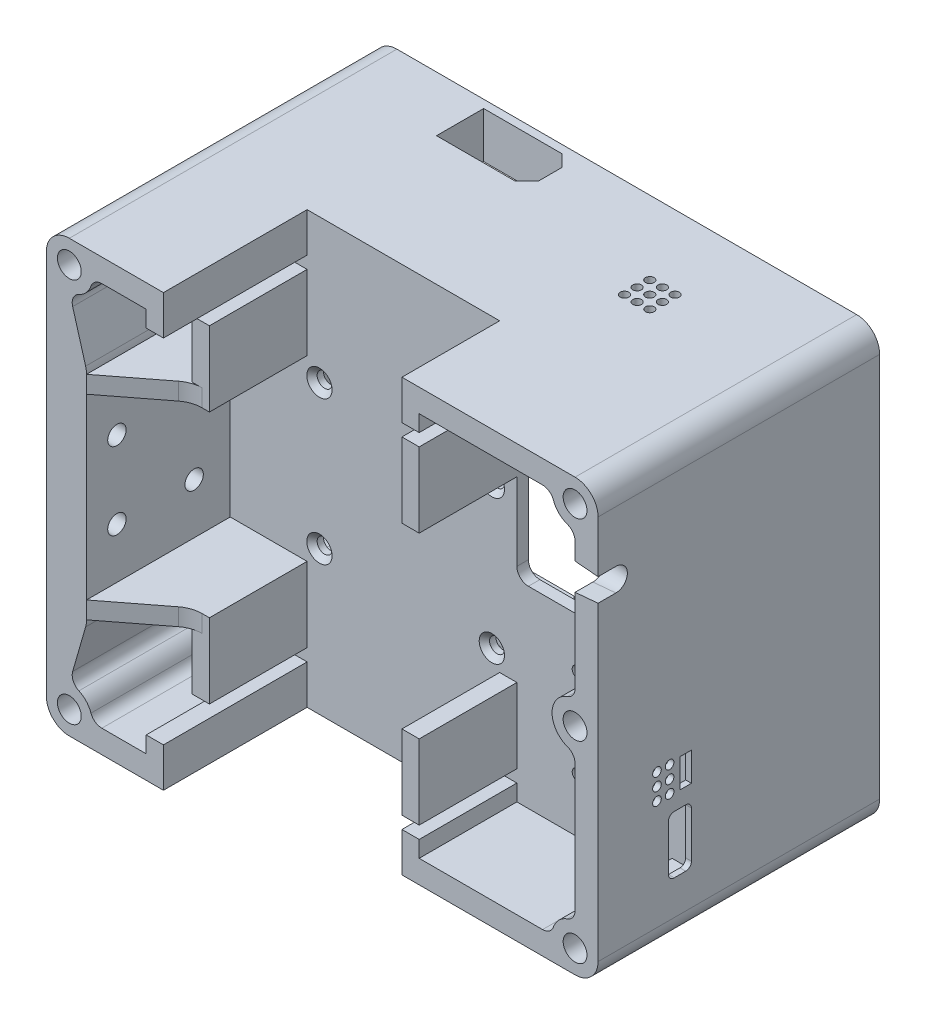
from build123d import *

# Parameters (mm, degrees)
SKETCH1_W                                      = 75
SKETCH1_H                                      = 88
BOSS_EXTRUDE1_DEPTH                            = 2
SKETCH2_W                                      = 3
SKETCH2_H                                      = 13
BOSS_EXTRUDE2_DEPTH                            = 17
SKETCH6_R                                      = 2.075
BOSS_EXTRUDE3_DEPTH                            = 17
SKETCH7_R                                      = 2.075
BOSS_EXTRUDE4_DEPTH                            = 25
SKETCH16_R                                     = 2
CUT_EXTRUDE5_DEPTH                             = 63.98610958
CUT_EXTRUDE2_REACH                             = 95.254
SKETCH8_R                                      = 1.6
BOSS_EXTRUDE5_DEPTH                            = 3
FILLET3_R                                      = 4
CUT_EXTRUDE6_REACH                             = 101.394
SKETCH17_R                                     = 0.75
SKETCH17_W                                     = 5
SKETCH17_H                                     = 2
CUT_EXTRUDE7_START                             = 1
SKETCH18_W                                     = 24
SKETCH18_H                                     = 8
SKETCH18_W_2                                   = 5
SKETCH18_H_2                                   = 2
SKETCH18_R                                     = 0.75
CUT_EXTRUDE7_DEPTH                             = 3.368532
BOSS_EXTRUDE6_START                            = 30
SKETCH19_R                                     = 2.075
BOSS_EXTRUDE6_DEPTH                            = 30
CUT_EXTRUDE8_REACH                             = 102.251
CSK_FOR_M2_FLAT_HEAD_MACHINE_SCREW1_AT_2_COUNT = 2
CSK_FOR_M2_FLAT_HEAD_MACHINE_SCREW1_AT_2_PITCH = 30
CSK_FOR_M2_FLAT_HEAD_MACHINE_SCREW1_AT_3_COUNT = 2
CSK_FOR_M2_FLAT_HEAD_MACHINE_SCREW1_AT_3_PITCH = 39.05124838
CSK_FOR_M2_FLAT_HEAD_MACHINE_SCREW1_AT_4_COUNT = 2
CSK_FOR_M2_FLAT_HEAD_MACHINE_SCREW1_AT_4_PITCH = 25
CUT_EXTRUDE9_REACH                             = 68.078
SKETCH24_R                                     = 1
CUT_EXTRUDE10_START                            = -2
CUT_EXTRUDE10_DEPTH                            = 2
CUT_EXTRUDE11_START                            = -2
CUT_EXTRUDE11_DEPTH                            = 2
FILLET4_R                                      = 5
BOSS_EXTRUDE7_DEPTH                            = 4
CUT_EXTRUDE12_DEPTH                            = 86.586213843
CUT_EXTRUDE12_DEPTH_BACK                       = 86.586213843
FILLET5_R                                      = 1
CUT_EXTRUDE13_DEPTH                            = 4
CUT_EXTRUDE13_DRAFT                            = 5
SKETCH32_R                                     = 0.75
CUT_EXTRUDE14_DEPTH                            = 92.983694207


with BuildPart() as part:
    # Sketch1 → Boss-Extrude1 (new body)
    with BuildSketch(Plane(origin=(0, 0, 0), x_dir=(0, 1, 0), z_dir=(0, 0, 1))):
        Rectangle(SKETCH1_W, SKETCH1_H)
    extrude(amount=BOSS_EXTRUDE1_DEPTH)

    # Sketch2 → Boss-Extrude2 (add)
    with BuildSketch(Plane.XY.offset(2)):
        with Locations((11.375727924, -22)):
            Rectangle(SKETCH2_W, SKETCH2_H)
        with Locations((-25.124272076, -22)):
            Rectangle(SKETCH2_W, SKETCH2_H)
    boss_extrude2 = extrude(amount=BOSS_EXTRUDE2_DEPTH)

    # Mirror1: Boss-Extrude2 across plane
    add(boss_extrude2.mirror(Plane.ZX))

    # Sketch6 → Boss-Extrude3 (add)
    with BuildSketch(Plane.XY.offset(2)):
        with BuildLine():
            Line((9.875727924, 37.5), (44, 37.5))
            Line((44, 37.5), (44, -37.5))
            Line((44, -37.5), (9.875727924, -37.5))
            Line((9.875727924, -37.5), (9.875727924, -33.5))
            Line((9.875727924, -33.5), (9.875727924, -30.65))
            Line((9.875727924, -30.65), (12.875727924, -30.65))
            Line((12.875727924, -30.65), (12.875727924, -33.5))
            Line((12.875727924, -33.5), (34.343145751, -33.5))
            ThreePointArc((34.343145751, -33.5), (35.497846289, -33.132993162), (36.228763834, -32.166666667))
            ThreePointArc((36.228763834, -32.166666667), (37.171572875, -30.671572875), (38.666666667, -29.728763834))
            ThreePointArc((38.666666667, -29.728763834), (39.632993162, -28.997846289), (40, -27.843145751))
            Line((40, -27.843145751), (40, -5.656854249))
            ThreePointArc((40, -5.656854249), (39.632993162, -4.502153711), (38.666666667, -3.771236166))
            ThreePointArc((38.666666667, -3.771236166), (36, 0), (38.666666667, 3.771236166))
            ThreePointArc((38.666666667, 3.771236166), (39.632993162, 4.502153711), (40, 5.656854249))
            Line((40, 5.656854249), (40, 27.843145751))
            ThreePointArc((40, 27.843145751), (39.632993162, 28.997846289), (38.666666667, 29.728763834))
            ThreePointArc((38.666666667, 29.728763834), (37.171572875, 30.671572875), (36.228763834, 32.166666667))
            ThreePointArc((36.228763834, 32.166666667), (35.497846289, 33.132993162), (34.343145751, 33.5))
            Line((34.343145751, 33.5), (12.875727924, 33.5))
            Line((12.875727924, 33.5), (12.875727924, 30.65))
            Line((12.875727924, 30.65), (9.875727924, 30.65))
            Line((9.875727924, 30.65), (9.875727924, 33.5))
            Line((9.875727924, 33.5), (9.875727924, 37.5))
        make_face()
        with Locations((40, 33.5)):
            Circle(SKETCH6_R, mode=Mode.SUBTRACT)
        with Locations((40, 0)):
            Circle(SKETCH6_R, mode=Mode.SUBTRACT)
        with Locations((40, -33.5)):
            Circle(SKETCH6_R, mode=Mode.SUBTRACT)
    extrude(amount=BOSS_EXTRUDE3_DEPTH)

    # Sketch7 → Boss-Extrude4 (add)
    with BuildSketch(Plane.XY.offset(2)):
        with BuildLine():
            Line((-23.624272076, 37.5), (-44, 37.5))
            Line((-44, 37.5), (-44, -37.5))
            Line((-44, -37.5), (-23.624272076, -37.5))
            Line((-23.624272076, -37.5), (-23.624272076, -33.5))
            Line((-23.624272076, -33.5), (-23.624272076, -30.65))
            Line((-23.624272076, -30.65), (-26.624272076, -30.65))
            Line((-26.624272076, -30.65), (-26.624272076, -33.5))
            Line((-26.624272076, -33.5), (-34.343145751, -33.5))
            ThreePointArc((-34.343145751, -33.5), (-35.497846289, -33.132993162), (-36.228763834, -32.166666667))
            ThreePointArc((-36.228763834, -32.166666667), (-37.047220534, -30.80164987), (-38.333165381, -29.863839614))
            ThreePointArc((-38.333165381, -29.863839614), (-39.317471365, -28.879954859), (-39.421595977, -27.492134429))
            Line((-39.421595977, -27.492134429), (-37.162165598, -19.648771858))
            ThreePointArc((-37.162165598, -19.648771858), (-37.040741383, -19.080080698), (-37, -18.5))
            Line((-37, -18.5), (-37, 18.5))
            ThreePointArc((-37, 18.5), (-37.040741383, 19.080080698), (-37.162165598, 19.648771858))
            Line((-37.162165598, 19.648771858), (-39.421595977, 27.492134429))
            ThreePointArc((-39.421595977, 27.492134429), (-39.317471365, 28.879954859), (-38.333165381, 29.863839614))
            ThreePointArc((-38.333165381, 29.863839614), (-37.047220534, 30.80164987), (-36.228763834, 32.166666667))
            ThreePointArc((-36.228763834, 32.166666667), (-35.497846289, 33.132993162), (-34.343145751, 33.5))
            Line((-34.343145751, 33.5), (-26.624272076, 33.5))
            Line((-26.624272076, 33.5), (-26.624272076, 30.65))
            Line((-26.624272076, 30.65), (-23.624272076, 30.65))
            Line((-23.624272076, 30.65), (-23.624272076, 33.5))
            Line((-23.624272076, 33.5), (-23.624272076, 37.5))
        make_face()
        with Locations((-40, 33.5)):
            Circle(SKETCH7_R, mode=Mode.SUBTRACT)
        with Locations((-40, -33.5)):
            Circle(SKETCH7_R, mode=Mode.SUBTRACT)
    extrude(amount=BOSS_EXTRUDE4_DEPTH)

    # Sketch16 → Cut-Extrude5 (cut, through all)
    with BuildSketch(Plane.XY.offset(2)):
        with Locations((-40, 33.5)):
            Circle(SKETCH16_R)
        with Locations((40, 33.5)):
            Circle(SKETCH16_R)
        with Locations((40, 0)):
            Circle(SKETCH16_R)
        with Locations((40, -33.5)):
            Circle(SKETCH16_R)
        with Locations((-40, -33.5)):
            Circle(SKETCH16_R)
    extrude(amount=-CUT_EXTRUDE5_DEPTH, mode=Mode.SUBTRACT)

    # Sketch8 → Cut-Extrude2 (cut, up to next)
    with BuildSketch(Plane.YZ.offset(-37), mode=Mode.PRIVATE) as cut_extrude2_sk1:
        with Locations(Location((6.717514421, 21.717514421, 0), (0, 0, 270))):
            Circle(SKETCH8_R)
    cut_extrude2_tool1 = extrude(cut_extrude2_sk1.sketch, amount=-CUT_EXTRUDE2_REACH, mode=Mode.PRIVATE) & part.part
    # Sketch8 → Cut-Extrude2 (cut, up to next)
    with BuildSketch(Plane.YZ.offset(-37), mode=Mode.PRIVATE) as cut_extrude2_sk2:
        with Locations(Location((-6.717514421, 21.717514421, 0), (0, 0, 270))):
            Circle(SKETCH8_R)
    cut_extrude2_tool2 = extrude(cut_extrude2_sk2.sketch, amount=-CUT_EXTRUDE2_REACH, mode=Mode.PRIVATE) & part.part
    # Sketch8 → Cut-Extrude2 (cut, up to next)
    with BuildSketch(Plane.YZ.offset(-37), mode=Mode.PRIVATE) as cut_extrude2_sk3:
        with Locations(Location((6.717514421, 8.282485579, 0), (0, 0, 270))):
            Circle(SKETCH8_R)
    cut_extrude2_tool3 = extrude(cut_extrude2_sk3.sketch, amount=-CUT_EXTRUDE2_REACH, mode=Mode.PRIVATE) & part.part
    # Sketch8 → Cut-Extrude2 (cut, up to next)
    with BuildSketch(Plane.YZ.offset(-37), mode=Mode.PRIVATE) as cut_extrude2_sk4:
        with Locations(Location((-6.717514421, 8.282485579, 0), (0, 0, 270))):
            Circle(SKETCH8_R)
    cut_extrude2_tool4 = extrude(cut_extrude2_sk4.sketch, amount=-CUT_EXTRUDE2_REACH, mode=Mode.PRIVATE) & part.part
    add(cut_extrude2_tool1.solids().sort_by_distance((-37, 6.717514, 21.717514))[0], mode=Mode.SUBTRACT)
    add(cut_extrude2_tool2.solids().sort_by_distance((-37, -6.717514, 21.717514))[0], mode=Mode.SUBTRACT)
    add(cut_extrude2_tool3.solids().sort_by_distance((-37, 6.717514, 8.282486))[0], mode=Mode.SUBTRACT)
    add(cut_extrude2_tool4.solids().sort_by_distance((-37, -6.717514, 8.282486))[0], mode=Mode.SUBTRACT)

    # Sketch10 → Boss-Extrude5 (add)
    with BuildSketch(Plane(origin=(0, -15.5, 0), x_dir=(-1, 0, 0), z_dir=(0, 1, 0))):
        Polygon((26.624272076, 2), (37, 2), (37, 27), (26.624272076, 19), align=None)
    boss_extrude5 = extrude(amount=-BOSS_EXTRUDE5_DEPTH)

    # Mirror2: Boss-Extrude5 across plane
    add(boss_extrude5.mirror(Plane.ZX))

    # Fillet3
    fillet3_edges = [part.edges().sort_by_distance(p)[0] for p in [
        (44, 37.5, 9.5),
        (44, -37.5, 9.5),
        (-44, -37.5, 13.5),
        (-44, 37.5, 13.5),
    ]]
    fillet(fillet3_edges, radius=FILLET3_R)

    # Sketch17 → Cut-Extrude6 (cut, up to next)
    with BuildSketch(Plane.YZ.offset(44), mode=Mode.PRIVATE) as cut_extrude6_sk1:
        with Locations(Location((-14.45, 8.75, 0), (0, 0, 270))):
            Circle(SKETCH17_R)
    cut_extrude6_tool1 = extrude(cut_extrude6_sk1.sketch, amount=-CUT_EXTRUDE6_REACH, mode=Mode.PRIVATE) & part.part
    # Sketch17 → Cut-Extrude6 (cut, up to next)
    with BuildSketch(Plane.YZ.offset(44), mode=Mode.PRIVATE) as cut_extrude6_sk2:
        with Locations(Location((-12.25, 8.75, 0), (0, 0, 270))):
            Circle(SKETCH17_R)
    cut_extrude6_tool2 = extrude(cut_extrude6_sk2.sketch, amount=-CUT_EXTRUDE6_REACH, mode=Mode.PRIVATE) & part.part
    # Sketch17 → Cut-Extrude6 (cut, up to next)
    with BuildSketch(Plane.YZ.offset(44), mode=Mode.PRIVATE) as cut_extrude6_sk3:
        with Locations(Location((-10.05, 8.75, 0), (0, 0, 270))):
            Circle(SKETCH17_R)
    cut_extrude6_tool3 = extrude(cut_extrude6_sk3.sketch, amount=-CUT_EXTRUDE6_REACH, mode=Mode.PRIVATE) & part.part
    # Sketch17 → Cut-Extrude6 (cut, up to next)
    with BuildSketch(Plane.YZ.offset(44), mode=Mode.PRIVATE) as cut_extrude6_sk4:
        with Locations(Location((-12.25, 6.55, 0), (0, 0, 270))):
            Circle(SKETCH17_R)
    cut_extrude6_tool4 = extrude(cut_extrude6_sk4.sketch, amount=-CUT_EXTRUDE6_REACH, mode=Mode.PRIVATE) & part.part
    # Sketch17 → Cut-Extrude6 (cut, up to next)
    with BuildSketch(Plane.YZ.offset(44), mode=Mode.PRIVATE) as cut_extrude6_sk5:
        with Locations(Location((-10.05, 6.55, 0), (0, 0, 270))):
            Circle(SKETCH17_R)
    cut_extrude6_tool5 = extrude(cut_extrude6_sk5.sketch, amount=-CUT_EXTRUDE6_REACH, mode=Mode.PRIVATE) & part.part
    # Sketch17 → Cut-Extrude6 (cut, up to next)
    with BuildSketch(Plane.YZ.offset(44), mode=Mode.PRIVATE) as cut_extrude6_sk6:
        with Locations(Location((-14.45, 6.55, 0), (0, 0, 270))):
            Circle(SKETCH17_R)
    cut_extrude6_tool6 = extrude(cut_extrude6_sk6.sketch, amount=-CUT_EXTRUDE6_REACH, mode=Mode.PRIVATE) & part.part
    # Sketch17 → Cut-Extrude6 (cut, up to next)
    with BuildSketch(Plane.YZ.offset(44), mode=Mode.PRIVATE) as cut_extrude6_sk7:
        with BuildLine():
            Line((-26.5, 6.75), (-18.5, 6.75))
            ThreePointArc((-18.5, 6.75), (-17.792893219, 6.457106781), (-17.5, 5.75))
            Line((-17.5, 5.75), (-17.5, 3.75))
            ThreePointArc((-17.5, 3.75), (-17.792893219, 3.042893219), (-18.5, 2.75))
            Line((-18.5, 2.75), (-26.5, 2.75))
            ThreePointArc((-26.5, 2.75), (-27.207106781, 3.042893219), (-27.5, 3.75))
            Line((-27.5, 3.75), (-27.5, 5.75))
            ThreePointArc((-27.5, 5.75), (-27.207106781, 6.457106781), (-26.5, 6.75))
        make_face()
    cut_extrude6_tool7 = extrude(cut_extrude6_sk7.sketch, amount=-CUT_EXTRUDE6_REACH, mode=Mode.PRIVATE) & part.part
    # Sketch17 → Cut-Extrude6 (cut, up to next)
    with BuildSketch(Plane.YZ.offset(44), mode=Mode.PRIVATE) as cut_extrude6_sk8:
        with Locations((-12.25, 3.75)):
            Rectangle(SKETCH17_W, SKETCH17_H)
    cut_extrude6_tool8 = extrude(cut_extrude6_sk8.sketch, amount=-CUT_EXTRUDE6_REACH, mode=Mode.PRIVATE) & part.part
    add(cut_extrude6_tool1.solids().sort_by_distance((44, -14.45, 8.75))[0], mode=Mode.SUBTRACT)
    add(cut_extrude6_tool2.solids().sort_by_distance((44, -12.25, 8.75))[0], mode=Mode.SUBTRACT)
    add(cut_extrude6_tool3.solids().sort_by_distance((44, -10.05, 8.75))[0], mode=Mode.SUBTRACT)
    add(cut_extrude6_tool4.solids().sort_by_distance((44, -12.25, 6.55))[0], mode=Mode.SUBTRACT)
    add(cut_extrude6_tool5.solids().sort_by_distance((44, -10.05, 6.55))[0], mode=Mode.SUBTRACT)
    add(cut_extrude6_tool6.solids().sort_by_distance((44, -14.45, 6.55))[0], mode=Mode.SUBTRACT)
    add(cut_extrude6_tool7.solids().sort_by_distance((44, -22.5, 4.75))[0], mode=Mode.SUBTRACT)
    add(cut_extrude6_tool8.solids().sort_by_distance((44, -12.25, 3.75))[0], mode=Mode.SUBTRACT)

    # Sketch18 → Cut-Extrude7 (cut)
    with BuildSketch(Plane(origin=(44, 0, 0), x_dir=(0, -1, 0), z_dir=(-1, 0, 0)).offset(CUT_EXTRUDE7_START)):
        with Locations((16.5, 6)):
            Rectangle(SKETCH18_W, SKETCH18_H)
        with Locations((12.25, 3.75)):
            Rectangle(SKETCH18_W_2, SKETCH18_H_2, mode=Mode.SUBTRACT)
        with Locations(Location((10.05, 6.55, 0), (0, 0, 270))):
            Circle(SKETCH18_R, mode=Mode.SUBTRACT)
        with Locations(Location((12.25, 6.55, 0), (0, 0, 270))):
            Circle(SKETCH18_R, mode=Mode.SUBTRACT)
        with Locations(Location((14.45, 6.55, 0), (0, 0, 270))):
            Circle(SKETCH18_R, mode=Mode.SUBTRACT)
        with Locations(Location((10.05, 8.75, 0), (0, 0, 270))):
            Circle(SKETCH18_R, mode=Mode.SUBTRACT)
        with Locations(Location((12.25, 8.75, 0), (0, 0, 270))):
            Circle(SKETCH18_R, mode=Mode.SUBTRACT)
        with Locations(Location((14.45, 8.75, 0), (0, 0, 270))):
            Circle(SKETCH18_R, mode=Mode.SUBTRACT)
        with BuildLine():
            ThreePointArc((26.5, 6.75), (27.207106781, 6.457106781), (27.5, 5.75))
            Line((27.5, 5.75), (27.5, 3.75))
            ThreePointArc((27.5, 3.75), (27.207106781, 3.042893219), (26.5, 2.75))
            Line((26.5, 2.75), (18.5, 2.75))
            ThreePointArc((18.5, 2.75), (17.792893219, 3.042893219), (17.5, 3.75))
            Line((17.5, 3.75), (17.5, 5.75))
            ThreePointArc((17.5, 5.75), (17.792893219, 6.457106781), (18.5, 6.75))
            Line((18.5, 6.75), (26.5, 6.75))
        make_face(mode=Mode.SUBTRACT)
    extrude(amount=CUT_EXTRUDE7_DEPTH, mode=Mode.SUBTRACT)

    # Sketch19 → Boss-Extrude6 (add)
    with BuildSketch(Plane(origin=(0, 0, 0), x_dir=(1, 0, 0), z_dir=(0, 0, -1)).offset(BOSS_EXTRUDE6_START)):
        with BuildLine():
            Line((-44, 33.5), (-44, -33.5))
            ThreePointArc((-44, -33.5), (-42.828427125, -36.328427125), (-40, -37.5))
            Line((-40, -37.5), (40, -37.5))
            ThreePointArc((40, -37.5), (42.828427125, -36.328427125), (44, -33.5))
            Line((44, -33.5), (44, 33.5))
            ThreePointArc((44, 33.5), (42.828427125, 36.328427125), (40, 37.5))
            Line((40, 37.5), (-40, 37.5))
            ThreePointArc((-40, 37.5), (-42.828427125, 36.328427125), (-44, 33.5))
        make_face()
        with Locations((-40, -33.5)):
            Circle(SKETCH19_R, mode=Mode.SUBTRACT)
        with Locations((40, -33.5)):
            Circle(SKETCH19_R, mode=Mode.SUBTRACT)
        with Locations((40, 0)):
            Circle(SKETCH19_R, mode=Mode.SUBTRACT)
        with Locations((40, 33.5)):
            Circle(SKETCH19_R, mode=Mode.SUBTRACT)
        with Locations((-40, 33.5)):
            Circle(SKETCH19_R, mode=Mode.SUBTRACT)
        with Locations(Location((32.5, 33.5, 0), (0, 0, 180))):
            Circle(SKETCH19_R, mode=Mode.SUBTRACT)
        with Locations(Location((-32.5, 33.5, 0), (0, 0, 180))):
            Circle(SKETCH19_R, mode=Mode.SUBTRACT)
        with Locations(Location((0, 33.5, 0), (0, 0, 180))):
            Circle(SKETCH19_R, mode=Mode.SUBTRACT)
        with Locations((32.5, -33.5)):
            Circle(SKETCH19_R, mode=Mode.SUBTRACT)
        with Locations((0, -33.5)):
            Circle(SKETCH19_R, mode=Mode.SUBTRACT)
        with Locations((-32.5, -33.5)):
            Circle(SKETCH19_R, mode=Mode.SUBTRACT)
        with BuildLine():
            Line((-26.843145751, 33.5), (-5.656854249, 33.5))
            ThreePointArc((-5.656854249, 33.5), (-4.502153711, 33.132993162), (-3.771236166, 32.166666667))
            ThreePointArc((-3.771236166, 32.166666667), (0, 29.5), (3.771236166, 32.166666667))
            ThreePointArc((3.771236166, 32.166666667), (4.502153711, 33.132993162), (5.656854249, 33.5))
            Line((5.656854249, 33.5), (26.843145751, 33.5))
            ThreePointArc((26.843145751, 33.5), (27.997846289, 33.132993162), (28.728763834, 32.166666667))
            ThreePointArc((28.728763834, 32.166666667), (30.190598923, 30.234013676), (32.5, 29.5))
            Line((32.5, 29.5), (38, 29.5))
            ThreePointArc((38, 29.5), (39.414213562, 28.914213562), (40, 27.5))
            Line((40, 27.5), (40, 5.656854249))
            ThreePointArc((40, 5.656854249), (39.632993162, 4.502153711), (38.666666667, 3.771236166))
            ThreePointArc((38.666666667, 3.771236166), (36, 0), (38.666666667, -3.771236166))
            ThreePointArc((38.666666667, -3.771236166), (39.632993162, -4.502153711), (40, -5.656854249))
            Line((40, -5.656854249), (40, -27.5))
            ThreePointArc((40, -27.5), (39.414213562, -28.914213562), (38, -29.5))
            Line((38, -29.5), (32.5, -29.5))
            ThreePointArc((32.5, -29.5), (30.190598923, -30.234013676), (28.728763834, -32.166666667))
            ThreePointArc((28.728763834, -32.166666667), (27.997846289, -33.132993162), (26.843145751, -33.5))
            Line((26.843145751, -33.5), (5.656854249, -33.5))
            ThreePointArc((5.656854249, -33.5), (4.502153711, -33.132993162), (3.771236166, -32.166666667))
            ThreePointArc((3.771236166, -32.166666667), (0, -29.5), (-3.771236166, -32.166666667))
            ThreePointArc((-3.771236166, -32.166666667), (-4.502153711, -33.132993162), (-5.656854249, -33.5))
            Line((-5.656854249, -33.5), (-26.843145751, -33.5))
            ThreePointArc((-26.843145751, -33.5), (-27.997846289, -33.132993162), (-28.728763834, -32.166666667))
            ThreePointArc((-28.728763834, -32.166666667), (-30.190598923, -30.234013676), (-32.5, -29.5))
            Line((-32.5, -29.5), (-38, -29.5))
            ThreePointArc((-38, -29.5), (-39.414213562, -28.914213562), (-40, -27.5))
            Line((-40, -27.5), (-40, 27.5))
            ThreePointArc((-40, 27.5), (-39.414213562, 28.914213562), (-38, 29.5))
            Line((-38, 29.5), (-32.5, 29.5))
            ThreePointArc((-32.5, 29.5), (-30.190598923, 30.234013676), (-28.728763834, 32.166666667))
            ThreePointArc((-28.728763834, 32.166666667), (-27.997846289, 33.132993162), (-26.843145751, 33.5))
        make_face(mode=Mode.SUBTRACT)
    extrude(amount=-BOSS_EXTRUDE6_DEPTH)

    # Sketch21 → Cut-Extrude8 (cut, up to next)
    with BuildSketch(Plane(origin=(-44, 0, 0), x_dir=(0, -1, 0), z_dir=(-1, 0, 0)), mode=Mode.PRIVATE) as cut_extrude8_sk1:
        with BuildLine():
            Line((1.5, -27), (-1.5, -27))
            ThreePointArc((-1.5, -27), (-2.560660172, -27.439339828), (-3, -28.5))
            Line((-3, -28.5), (-3, -30))
            Line((-3, -30), (3, -30))
            Line((3, -30), (3, -28.5))
            ThreePointArc((3, -28.5), (2.560660172, -27.439339828), (1.5, -27))
        make_face()
    cut_extrude8_tool1 = extrude(cut_extrude8_sk1.sketch, amount=-CUT_EXTRUDE8_REACH, mode=Mode.PRIVATE) & part.part
    add(cut_extrude8_tool1.solids().sort_by_distance((-44, 0, -28.566043))[0], mode=Mode.SUBTRACT)

    # Sketch23 → CSK for M2 Flat Head Machine Screw1 (revolve, cut)
    with BuildSketch(Plane(origin=(-21.478873585, -12.5, 2), x_dir=(0, -1, 0), z_dir=(1, 0, 0))):
        Polygon((0, 0), (0, 2), (1.3, 2), (1.3, 0.9), (2.2, 0), align=None)
    csk_for_m2_flat_head_machine_screw1 = revolve(axis=Axis((-21.478873585, -12.5, 8.35), (0, 0, -1)), mode=Mode.SUBTRACT)

    # CSK for M2 Flat Head Machine Screw1 at 2: CSK for M2 Flat Head Machine Screw1 ×2
    with Locations(*[(i * CSK_FOR_M2_FLAT_HEAD_MACHINE_SCREW1_AT_2_PITCH, 0, 0) for i in range(1, CSK_FOR_M2_FLAT_HEAD_MACHINE_SCREW1_AT_2_COUNT)]):
        add(csk_for_m2_flat_head_machine_screw1, mode=Mode.SUBTRACT)

    # CSK for M2 Flat Head Machine Screw1 at 3: CSK for M2 Flat Head Machine Screw1 ×2
    with Locations(*[Vector(0.7682212795973759, 0.6401843996644799, 0) * (i * CSK_FOR_M2_FLAT_HEAD_MACHINE_SCREW1_AT_3_PITCH) for i in range(1, CSK_FOR_M2_FLAT_HEAD_MACHINE_SCREW1_AT_3_COUNT)]):
        add(csk_for_m2_flat_head_machine_screw1, mode=Mode.SUBTRACT)

    # CSK for M2 Flat Head Machine Screw1 at 4: CSK for M2 Flat Head Machine Screw1 ×2
    with Locations(*[(0, i * CSK_FOR_M2_FLAT_HEAD_MACHINE_SCREW1_AT_4_PITCH, 0) for i in range(1, CSK_FOR_M2_FLAT_HEAD_MACHINE_SCREW1_AT_4_COUNT)]):
        add(csk_for_m2_flat_head_machine_screw1, mode=Mode.SUBTRACT)

    # Sketch24 → Cut-Extrude9 (cut, up to next)
    with BuildSketch(Plane.XY.offset(2), mode=Mode.PRIVATE) as cut_extrude9_sk1:
        with Locations((23.5, -8.65)):
            Circle(SKETCH24_R)
    cut_extrude9_tool1 = extrude(cut_extrude9_sk1.sketch, amount=-CUT_EXTRUDE9_REACH, mode=Mode.PRIVATE) & part.part
    # Sketch24 → Cut-Extrude9 (cut, up to next)
    with BuildSketch(Plane.XY.offset(2), mode=Mode.PRIVATE) as cut_extrude9_sk2:
        with Locations((23.5, -24.15)):
            Circle(SKETCH24_R)
    cut_extrude9_tool2 = extrude(cut_extrude9_sk2.sketch, amount=-CUT_EXTRUDE9_REACH, mode=Mode.PRIVATE) & part.part
    add(cut_extrude9_tool1.solids().sort_by_distance((23.5, -8.65, 2))[0], mode=Mode.SUBTRACT)
    add(cut_extrude9_tool2.solids().sort_by_distance((23.5, -24.15, 2))[0], mode=Mode.SUBTRACT)

    # Sketch12 → Cut-Extrude10 (cut)
    with BuildSketch(Plane.XY.offset(2).offset(CUT_EXTRUDE10_START)):
        with BuildLine():
            ThreePointArc((36.228763834, 32.166666667), (37.171572875, 30.671572875), (38.666666667, 29.728763834))
            ThreePointArc((38.666666667, 29.728763834), (39.632993162, 28.997846289), (40, 27.843145751))
            Line((40, 27.843145751), (40, 5.656854249))
            ThreePointArc((40, 5.656854249), (39.632993162, 4.502153711), (38.666666667, 3.771236166))
            ThreePointArc((38.666666667, 3.771236166), (36.734013676, 2.309401077), (36, 0))
            Line((36, 0), (14.875727924, 0))
            ThreePointArc((14.875727924, 0), (13.461514362, 0.585786438), (12.875727924, 2))
            Line((12.875727924, 2), (12.875727924, 33.5))
            Line((12.875727924, 33.5), (34.343145751, 33.5))
            ThreePointArc((34.343145751, 33.5), (35.497846289, 33.132993162), (36.228763834, 32.166666667))
        make_face()
    extrude(amount=CUT_EXTRUDE10_DEPTH, mode=Mode.SUBTRACT)

    # Sketch25 → Cut-Extrude11 (cut)
    with BuildSketch(Plane.XY.offset(2).offset(CUT_EXTRUDE11_START)):
        with BuildLine():
            Line((-26.624272076, 33.5), (-26.624272076, 18.5))
            Line((-26.624272076, 18.5), (-37, 18.5))
            ThreePointArc((-37, 18.5), (-37.040741383, 19.080080698), (-37.162165598, 19.648771858))
            Line((-37.162165598, 19.648771858), (-39.421595977, 27.492134429))
            ThreePointArc((-39.421595977, 27.492134429), (-39.317471365, 28.879954859), (-38.333165381, 29.863839614))
            ThreePointArc((-38.333165381, 29.863839614), (-37.047220534, 30.80164987), (-36.228763834, 32.166666667))
            ThreePointArc((-36.228763834, 32.166666667), (-35.497846289, 33.132993162), (-34.343145751, 33.5))
            Line((-34.343145751, 33.5), (-26.624272076, 33.5))
        make_face()
        with BuildLine():
            Line((-26.624272076, -18.5), (-26.624272076, -33.5))
            Line((-26.624272076, -33.5), (-34.343145751, -33.5))
            ThreePointArc((-34.343145751, -33.5), (-35.497846289, -33.132993162), (-36.228763834, -32.166666667))
            ThreePointArc((-36.228763834, -32.166666667), (-37.047220534, -30.80164987), (-38.333165381, -29.863839614))
            ThreePointArc((-38.333165381, -29.863839614), (-39.317471365, -28.879954859), (-39.421595977, -27.492134429))
            Line((-39.421595977, -27.492134429), (-37.162165598, -19.648771858))
            ThreePointArc((-37.162165598, -19.648771858), (-37.040741383, -19.080080698), (-37, -18.5))
            Line((-37, -18.5), (-26.624272076, -18.5))
        make_face()
    extrude(amount=CUT_EXTRUDE11_DEPTH, mode=Mode.SUBTRACT)

    # Fillet4
    fillet4_edges = [part.edges().sort_by_distance(p)[0] for p in [
        (-26.624272076, -17, 19),
        (-26.624272076, 17, 19),
    ]]
    fillet(fillet4_edges, radius=FILLET4_R)

    # Sketch26 → Boss-Extrude7 (add)
    with BuildSketch(Plane(origin=(0, -33.5, 0), x_dir=(-1, 0, 0), z_dir=(0, 1, 0))):
        Polygon((9.156854249, -19), (6.656854249, -21.5), (6.656854249, -27.5), (9.156854249, -30), (24.656854249, -30), (24.656854249, -19), align=None)
    boss_extrude7 = extrude(amount=BOSS_EXTRUDE7_DEPTH)

    # Mirror6: Boss-Extrude7 across plane
    add(boss_extrude7.mirror(Plane.ZX))

    # Sketch28 → Cut-Extrude12 (cut, two sides: drawn at the far end of the back side and taken through both)
    with BuildSketch(Plane(origin=(0, -29.5, 0), x_dir=(-1, 0, 0), z_dir=(0, 1, 0)).offset(-CUT_EXTRUDE12_DEPTH_BACK)):
        Polygon((9.856854249, -20.4), (23.506854249, -20.4), (23.506854249, -28.6), (9.856854249, -28.6), (7.806854249, -26.55), (7.806854249, -22.45), align=None)
    extrude(amount=CUT_EXTRUDE12_DEPTH + CUT_EXTRUDE12_DEPTH_BACK, mode=Mode.SUBTRACT)

    # Fillet5
    fillet5_edges = [part.edges().sort_by_distance(p)[0] for p in [
        (-24.656854249, -33.5, -24.5),
        (-16.906854249, -33.5, -19),
        (-24.656854249, -31.5, -19),
        (-7.906854249, -33.5, -20.25),
        (-9.156854249, -31.5, -19),
        (-6.656854249, -33.5, -24.5),
        (-6.656854249, -31.5, -21.5),
        (-7.906854249, -33.5, -28.75),
        (-6.656854249, -31.5, -27.5),
        (-24.656854249, 31.5, -19),
        (-6.656854249, 31.5, -27.5),
        (-6.656854249, 31.5, -21.5),
        (-9.156854249, 31.5, -19),
        (-24.656854249, 33.5, -24.5),
        (-16.906854249, 33.5, -19),
        (-7.906854249, 33.5, -20.25),
        (-6.656854249, 33.5, -24.5),
        (-7.906854249, 33.5, -28.75),
    ]]
    fillet(fillet5_edges, radius=FILLET5_R - 0.0001)  # a hair under: the kernel refuses the full size


with BuildPart() as cut_extrude13_tool:
    # Sketch29 → Cut-Extrude13 (with draft: the straight prism first)
    with BuildSketch(Plane.YZ.offset(44)):
        with BuildLine():
            Line((20.5, 19), (20.5, 15.9))
            ThreePointArc((20.5, 15.9), (22.5, 13.9), (24.5, 15.9))
            Line((24.5, 15.9), (24.5, 19))
            Line((24.5, 19), (20.5, 19))
        make_face()
    extrude(amount=-CUT_EXTRUDE13_DEPTH)
    # Cut-Extrude13: the draft: its side faces are tilted about the plane it starts from
    cut_extrude13_sides = [cut_extrude13_tool.faces().sort_by_distance(p)[0] for p in [
        (42, 24.5, 17.45),
        (42, 22.5, 19),
        (42, 20.5, 17.45),
        (42, 22.5, 13.9),
    ]]
    draft(cut_extrude13_sides, Plane.YZ.offset(44), CUT_EXTRUDE13_DRAFT)


with BuildPart() as part_1:
    add(part.part)

    # Cut-Extrude13: cut by cut_extrude13_tool
    add(cut_extrude13_tool.part, mode=Mode.SUBTRACT)

    # Sketch32 → Cut-Extrude14 (cut, through all)
    with BuildSketch(Plane(origin=(0, 37.5, 0), x_dir=(-1, 0, 0), z_dir=(0, 1, 0))):
        with Locations((-21.2, -17.2)):
            Circle(SKETCH32_R)
        with Locations((-19, -17.2)):
            Circle(SKETCH32_R)
        with Locations((-16.8, -17.2)):
            Circle(SKETCH32_R)
        with Locations((-19, -15)):
            Circle(SKETCH32_R)
        with Locations((-16.8, -15)):
            Circle(SKETCH32_R)
        with Locations((-19, -12.8)):
            Circle(SKETCH32_R)
        with Locations((-16.8, -12.8)):
            Circle(SKETCH32_R)
        with Locations((-21.2, -15)):
            Circle(SKETCH32_R)
        with Locations((-21.2, -12.8)):
            Circle(SKETCH32_R)
    extrude(amount=-CUT_EXTRUDE14_DEPTH, mode=Mode.SUBTRACT)


solid = part_1.part
